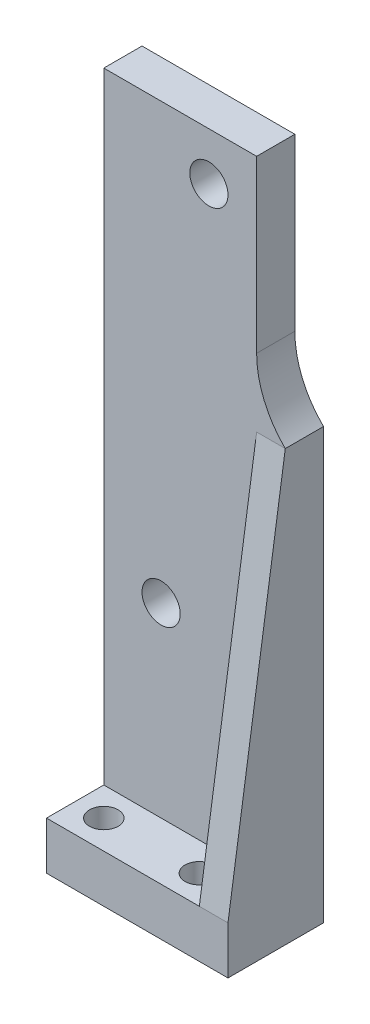
from build123d import *

# Parameters (mm, degrees)
SKETCH_1_W          = 16
SKETCH_1_H          = 6
SKETCH_1_R          = 1.5
EXTRUDE_1_DEPTH     = 5
SKETCH_2_W          = 16
SKETCH_2_H          = 70
EXTRUDE_2_DEPTH     = 4
SKETCH_3_R          = 2
CUT_EXTRUDE_1_DEPTH = 72.414284285
SKETCH_4_R          = 2
CUT_EXTRUDE_2_DEPTH = 72.414284285
SKETCH_5_R          = 3.5
CUT_EXTRUDE_3_DEPTH = 0.8
EXTRUDE_3_DEPTH     = 3
FILLET_1_R          = 10


with BuildPart() as part:
    # 草图1 → 凸台-拉伸1 (new body)
    with BuildSketch(Plane(origin=(0, 0, 0), x_dir=(1, 0, 0), z_dir=(0, 1, 0))):
        with Locations((2, 0)):
            Rectangle(SKETCH_1_W, SKETCH_1_H)
        with Locations(Location((-3, 0, 0), (0, 0, 270))):
            Circle(SKETCH_1_R, mode=Mode.SUBTRACT)
        with Locations(Location((7, 0, 0), (0, 0, 270))):
            Circle(SKETCH_1_R, mode=Mode.SUBTRACT)
    extrude(amount=EXTRUDE_1_DEPTH)

    # 草图2 → 凸台-拉伸2 (add)
    with BuildSketch(Plane(origin=(0, 0, -3), x_dir=(-1, 0, 0), z_dir=(0, 0, -1))):
        with Locations((-2, 35)):
            Rectangle(SKETCH_2_W, SKETCH_2_H)
    extrude(amount=EXTRUDE_2_DEPTH)

    # 草图3 → 切除-拉伸1 (cut, through all)
    with BuildSketch(Plane(origin=(0, 0, -7), x_dir=(-1, 0, 0), z_dir=(0, 0, -1))):
        with Locations((-5, 65)):
            Circle(SKETCH_3_R)
    extrude(amount=-CUT_EXTRUDE_1_DEPTH, mode=Mode.SUBTRACT)

    # 草图4 → 切除-拉伸2 (cut, through all)
    with BuildSketch(Plane(origin=(0, 0, -7), x_dir=(-1, 0, 0), z_dir=(0, 0, -1))):
        with Locations((0, 24.5)):
            Circle(SKETCH_4_R)
    extrude(amount=-CUT_EXTRUDE_2_DEPTH, mode=Mode.SUBTRACT)

    # 草图5 → 切除-拉伸3 (cut)
    with BuildSketch(Plane(origin=(0, 0, -7), x_dir=(-1, 0, 0), z_dir=(0, 0, -1))):
        with Locations((-5, 65)):
            Circle(SKETCH_5_R)
    extrude(amount=-CUT_EXTRUDE_3_DEPTH, mode=Mode.SUBTRACT)

    # 草图6 → 凸台-拉伸3 (add)
    with BuildSketch(Plane(origin=(10, 0, 0), x_dir=(0, 0, -1), z_dir=(1, 0, 0))):
        Polygon((3, 5), (-3, 5), (-3, 0), (7, 0), (7, 45), (3, 45), align=None)
        Polygon((3, 45), (-3, 5), (3, 5), align=None)
    extrude(amount=EXTRUDE_3_DEPTH)

    # 圆角1
    # the kernel refuses this fillet: 10 mm, written as the material it adds along each edge
    with BuildSketch(Plane(origin=(10, 45, -7), x_dir=(0, 1, 0), z_dir=(0, 0, 1))) as fillet_1_piece_1:
        with BuildLine():
            CenterArc((7.141428429, -10), FILLET_1_R, 90, 45.572995999)
            Line((0, -3), (0, 0))
            Line((0, 0), (7.141428429, 0))
        make_face()
    extrude(amount=4)


solid = part.part
